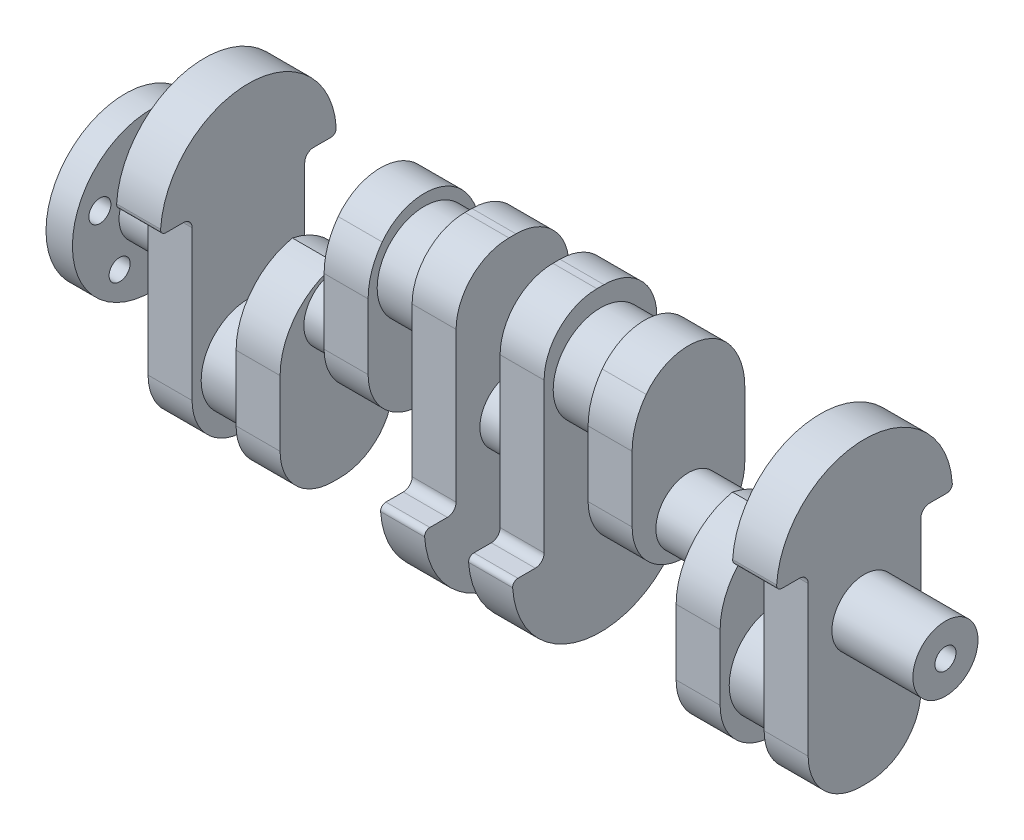
from build123d import *

# Parameters (mm, degrees)
SKETCH1_W           = 25
SKETCH1_H           = 26.85
SKETCH1_5_W         = 25
SKETCH1_5_H         = 26.85
SKETCH1_8_W         = 25
SKETCH1_8_H         = 18.498346322
SKETCH1_9_W         = 25
SKETCH1_9_H         = 170
SKETCH1_9_H_2       = 107.25
BOSS_EXTRUDE1_DEPTH = 32
FILLET1_R           = 30
FILLET3_R           = 40
SKETCH2_W           = 25
SKETCH2_H           = 50
BOSS_EXTRUDE2_DEPTH = 50
FILLET12_R          = 50
FILLET13_R          = 50
FILLET14_R          = 50
FILLET15_R          = 50
FILLET16_R          = 30
FILLET17_R          = 3
FILLET18_R          = 5
SKETCH3_R           = 18.498346322
BOSS_EXTRUDE3_DEPTH = 21
BOSS_EXTRUDE4_START = 5
SKETCH4_R           = 18.498346322
BOSS_EXTRUDE4_DEPTH = 5
SKETCH5_R           = 45
BOSS_EXTRUDE5_DEPTH = 15
CUT_EXTRUDE1_DEPTH  = 15
SKETCH7_R           = 6
CUT_EXTRUDE2_DEPTH  = 20


# Some blends are built 0.0001 mm under size
with BuildPart() as part:
    # Sketch1 → Revolve1 (revolve)
    with BuildSketch(Plane.XY, mode=Mode.PRIVATE) as revolve1_sk:
        with Locations((162.5, 61.175)):
            Rectangle(SKETCH1_W, SKETCH1_H)
        with Locations((262.5, 61.175)):
            Rectangle(SKETCH1_W, SKETCH1_H)
    revolve(revolve1_sk.sketch.rotate(Axis((150, 47.75, 0), (1, 0, 0)), 90), axis=Axis((150, 47.75, 0), (1, 0, 0)))



with BuildPart() as body_2:
    # Sketch1<5> → Revolve3 (revolve)
    with BuildSketch(Plane.XY, mode=Mode.PRIVATE) as revolve3_sk:
        with Locations((62.5, -34.325)):
            Rectangle(SKETCH1_5_W, SKETCH1_5_H)
        with Locations((362.5, -34.325)):
            Rectangle(SKETCH1_5_W, SKETCH1_5_H)
    revolve(revolve3_sk.sketch.rotate(Axis((50, -47.75, 0), (1, 0, 0)), 90), axis=Axis((50, -47.75, 0), (1, 0, 0)))


with BuildPart() as body_3:
    # Sketch1<8> → Revolve4 (revolve)
    with BuildSketch(Plane.XY, mode=Mode.PRIVATE) as revolve4_sk:
        with Locations((12.5, 9.249173161)):
            Rectangle(SKETCH1_8_W, SKETCH1_8_H)
        with Locations((112.5, 9.249173161)):
            Rectangle(SKETCH1_8_W, SKETCH1_8_H)
        with Locations((212.5, 9.249173161)):
            Rectangle(SKETCH1_8_W, SKETCH1_8_H)
        with Locations((312.5, 9.249173161)):
            Rectangle(SKETCH1_8_W, SKETCH1_8_H)
        with Locations((412.5, 9.249173161)):
            Rectangle(SKETCH1_8_W, SKETCH1_8_H)
    revolve(revolve4_sk.sketch.rotate(Axis((75, 0, 0), (1, 0, 0)), 90), axis=Axis((75, 0, 0), (1, 0, 0)))


with BuildPart() as part_1:
    add(part.part)

    add(body_2.part)  # Boss-Extrude1 merges body 2

    add(body_3.part)  # Boss-Extrude1 merges body 3
    # Sketch1<9> → Boss-Extrude1 (add, symmetric)
    with BuildSketch(Plane.XY):
        with Locations((37.5, 0)):
            Rectangle(SKETCH1_9_W, SKETCH1_9_H)
        with Locations((87.5, -31.375)):
            Rectangle(SKETCH1_9_W, SKETCH1_9_H_2)
        with Locations((187.5, 0)):
            Rectangle(SKETCH1_9_W, SKETCH1_9_H)
        with Locations((137.5, 31.375)):
            Rectangle(SKETCH1_9_W, SKETCH1_9_H_2)
        with Locations((237.5, 0)):
            Rectangle(SKETCH1_9_W, SKETCH1_9_H)
        with Locations((337.5, -31.375)):
            Rectangle(SKETCH1_9_W, SKETCH1_9_H_2)
        with Locations((287.5, 31.375)):
            Rectangle(SKETCH1_9_W, SKETCH1_9_H_2)
        with Locations((387.5, 0)):
            Rectangle(SKETCH1_9_W, SKETCH1_9_H)
    extrude(amount=BOSS_EXTRUDE1_DEPTH, both=True)

    # Fillet1
    fillet1_edges = [part_1.edges().sort_by_distance(p)[0] for p in [
        (37.5, -85, -32),
        (37.5, -85, 32),
        (137.5, -22.25, 32),
        (137.5, -22.25, -32),
        (87.5, -85, 32),
        (87.5, -85, -32),
        (187.5, 85, -32),
        (187.5, 85, 32),
        (237.5, 85, -32),
        (237.5, 85, 32),
        (287.5, -22.25, 32),
        (287.5, -22.25, -32),
        (337.5, -85, 32),
        (337.5, -85, -32),
        (387.5, -85, 32),
        (387.5, -85, -32),
    ]]
    fillet(fillet1_edges, radius=FILLET1_R)

    # Fillet3
    # the kernel refuses this fillet: 40 mm, written as the material it takes off along each edge
    with BuildSketch(Plane(origin=(400, 85, -32), x_dir=(0, -1, 0), z_dir=(-1, 0, 0))) as fillet3_piece_1_section:
        with BuildLine():
            CenterArc((FILLET3_R, FILLET3_R), FILLET3_R, 180, 90)
            Line((0, FILLET3_R), (0, 0))
            Line((0, 0), (FILLET3_R, 0))
        make_face()
    fillet3_piece_1 = extrude(amount=125, mode=Mode.PRIVATE)
    fillet3_piece_1 = split(fillet3_piece_1, bisect_by=Plane(origin=(375, 50.180054466, -31.891838311), z_dir=(-1, 0, 0)), keep=Keep.TOP, mode=Mode.PRIVATE)
    add(fillet3_piece_1, mode=Mode.SUBTRACT)
    with BuildSketch(Plane(origin=(400, 85, 32), x_dir=(0, 0, -1), z_dir=(-1, 0, 0))) as fillet3_piece_2_section:
        with BuildLine():
            CenterArc((FILLET3_R, FILLET3_R), FILLET3_R, 180, 90)
            Line((0, FILLET3_R), (0, 0))
            Line((0, 0), (FILLET3_R, 0))
        make_face()
    fillet3_piece_2 = extrude(amount=125, mode=Mode.PRIVATE)
    fillet3_piece_2 = split(fillet3_piece_2, bisect_by=Plane(origin=(375, 84.961169629, -4.892183964), z_dir=(-1, 0, 0)), keep=Keep.TOP, mode=Mode.PRIVATE)
    add(fillet3_piece_2, mode=Mode.SUBTRACT)
    with BuildSketch(Plane(origin=(250, 85, -32), x_dir=(0, -1, 0), z_dir=(-1, 0, 0))) as fillet3_piece_3_section:
        with BuildLine():
            CenterArc((FILLET3_R, FILLET3_R), FILLET3_R, 180, 90)
            Line((0, FILLET3_R), (0, 0))
            Line((0, 0), (FILLET3_R, 0))
        make_face()
    fillet3_piece_3 = extrude(amount=125, mode=Mode.PRIVATE)
    fillet3_piece_3 = split(fillet3_piece_3, bisect_by=Plane(origin=(175, 50.180054466, -31.891838311), z_dir=(-1, 0, 0)), keep=Keep.TOP, mode=Mode.PRIVATE)
    add(fillet3_piece_3, mode=Mode.SUBTRACT)
    with BuildSketch(Plane(origin=(250, 85, 32), x_dir=(0, 0, -1), z_dir=(-1, 0, 0))) as fillet3_piece_4_section:
        with BuildLine():
            CenterArc((FILLET3_R, FILLET3_R), FILLET3_R, 180, 90)
            Line((0, FILLET3_R), (0, 0))
            Line((0, 0), (FILLET3_R, 0))
        make_face()
    fillet3_piece_4 = extrude(amount=125, mode=Mode.PRIVATE)
    fillet3_piece_4 = split(fillet3_piece_4, bisect_by=Plane(origin=(175, 84.961169629, -4.892183964), z_dir=(-1, 0, 0)), keep=Keep.TOP, mode=Mode.PRIVATE)
    add(fillet3_piece_4, mode=Mode.SUBTRACT)
    with BuildSketch(Plane(origin=(450, 22.25, -32), x_dir=(0, -1, 0), z_dir=(-1, 0, 0))) as fillet3_piece_5_section:
        with BuildLine():
            CenterArc((FILLET3_R, FILLET3_R), FILLET3_R, 180, 90)
            Line((0, FILLET3_R), (0, 0))
            Line((0, 0), (FILLET3_R, 0))
        make_face()
    fillet3_piece_5 = extrude(amount=125, mode=Mode.PRIVATE)
    fillet3_piece_5 = split(fillet3_piece_5, bisect_by=Plane(origin=(375, -4.532523645, -31.278935782), z_dir=(-1, 0, 0)), keep=Keep.TOP, mode=Mode.PRIVATE)
    add(fillet3_piece_5, mode=Mode.SUBTRACT)
    with BuildSketch(Plane(origin=(450, 22.25, 32), x_dir=(0, 0, -1), z_dir=(-1, 0, 0))) as fillet3_piece_6_section:
        with BuildLine():
            CenterArc((FILLET3_R, FILLET3_R), FILLET3_R, 180, 90)
            Line((0, FILLET3_R), (0, 0))
            Line((0, 0), (FILLET3_R, 0))
        make_face()
    fillet3_piece_6 = extrude(amount=125, mode=Mode.PRIVATE)
    fillet3_piece_6 = split(fillet3_piece_6, bisect_by=Plane(origin=(375, 21.818010891, 2.113463403), z_dir=(-1, 0, 0)), keep=Keep.TOP, mode=Mode.PRIVATE)
    add(fillet3_piece_6, mode=Mode.SUBTRACT)
    with BuildSketch(Plane(origin=(200, 22.25, -32), x_dir=(0, -1, 0), z_dir=(-1, 0, 0))) as fillet3_piece_7_section:
        with BuildLine():
            CenterArc((FILLET3_R, FILLET3_R), FILLET3_R, 180, 90)
            Line((0, FILLET3_R), (0, 0))
            Line((0, 0), (FILLET3_R, 0))
        make_face()
    fillet3_piece_7 = extrude(amount=125, mode=Mode.PRIVATE)
    fillet3_piece_7 = split(fillet3_piece_7, bisect_by=Plane(origin=(125, -4.532523645, -31.278935782), z_dir=(-1, 0, 0)), keep=Keep.TOP, mode=Mode.PRIVATE)
    add(fillet3_piece_7, mode=Mode.SUBTRACT)
    with BuildSketch(Plane(origin=(200, 22.25, 32), x_dir=(0, 0, -1), z_dir=(-1, 0, 0))) as fillet3_piece_8_section:
        with BuildLine():
            CenterArc((FILLET3_R, FILLET3_R), FILLET3_R, 180, 90)
            Line((0, FILLET3_R), (0, 0))
            Line((0, 0), (FILLET3_R, 0))
        make_face()
    fillet3_piece_8 = extrude(amount=125, mode=Mode.PRIVATE)
    fillet3_piece_8 = split(fillet3_piece_8, bisect_by=Plane(origin=(125, 21.818010891, 2.113463403), z_dir=(-1, 0, 0)), keep=Keep.TOP, mode=Mode.PRIVATE)
    add(fillet3_piece_8, mode=Mode.SUBTRACT)

    # Sketch2 → Boss-Extrude2 (add, symmetric)
    with BuildSketch(Plane.XY):
        with Locations((37.5, 60)):
            Rectangle(SKETCH2_W, SKETCH2_H)
        with Locations((187.5, -60)):
            Rectangle(SKETCH2_W, SKETCH2_H)
        with Locations((237.5, -60)):
            Rectangle(SKETCH2_W, SKETCH2_H)
        with Locations((387.5, 60)):
            Rectangle(SKETCH2_W, SKETCH2_H)
    extrude(amount=BOSS_EXTRUDE2_DEPTH, both=True)

    # Fillet12
    fillet12_edges = [part_1.edges().sort_by_distance(p)[0] for p in [
        (37.5, 85, -50),
        (37.5, 85, 50),
    ]]
    fillet(fillet12_edges, radius=FILLET12_R - 0.0001)  # a hair under: the kernel refuses the full size

    # Fillet13
    fillet13_edges = [part_1.edges().sort_by_distance(p)[0] for p in [
        (387.5, 85, -50),
        (387.5, 85, 50),
    ]]
    fillet(fillet13_edges, radius=FILLET13_R - 0.0001)  # a hair under: the kernel refuses the full size

    # Fillet14
    fillet14_edges = [part_1.edges().sort_by_distance(p)[0] for p in [
        (187.5, -85, -50),
        (187.5, -85, 50),
    ]]
    fillet(fillet14_edges, radius=FILLET14_R - 0.0001)  # a hair under: the kernel refuses the full size

    # Fillet15
    fillet15_edges = [part_1.edges().sort_by_distance(p)[0] for p in [
        (237.5, -85, -50),
        (237.5, -85, 50),
    ]]
    fillet(fillet15_edges, radius=FILLET15_R - 0.0001)  # a hair under: the kernel refuses the full size

    # Fillet16
    fillet16_edges = [part_1.edges().sort_by_distance(p)[0] for p in [
        (287.5, 84.191835885, 0),
        (137.5, 84.191835885, 0),
    ]]
    fillet(fillet16_edges, radius=FILLET16_R)

    # Fillet17
    fillet17_edges = [part_1.edges().sort_by_distance(p)[0] for p in [
        (37.5, 35, -50),
        (37.5, 35, 50),
        (187.5, -35, -50),
        (187.5, -35, 50),
        (237.5, -35, -50),
        (237.5, -35, 50),
        (387.5, 35, -50),
        (387.5, 35, 50),
    ]]
    fillet(fillet17_edges, radius=FILLET17_R)

    # Fillet18
    fillet18_edges = [part_1.edges().sort_by_distance(p)[0] for p in [
        (37.5, 35, -32),
        (387.5, 35, -32),
        (237.5, -35, -32),
        (187.5, -35, -32),
        (37.5, 35, 32),
        (187.5, -35, 32),
        (237.5, -35, 32),
        (387.5, 35, 32),
    ]]
    fillet(fillet18_edges, radius=FILLET18_R)

    # Sketch3 → Boss-Extrude3 (add)
    with BuildSketch(Plane(origin=(425, 0, 0), x_dir=(0, 0, -1), z_dir=(1, 0, 0))):
        with Locations(Location((0, 0, 0), (0, 0, 180))):
            Circle(SKETCH3_R)
    extrude(amount=BOSS_EXTRUDE3_DEPTH)

    # Sketch4 → Boss-Extrude4 (add)
    with BuildSketch(Plane.ZY.offset(BOSS_EXTRUDE4_START)):
        Circle(SKETCH4_R)
    extrude(amount=-BOSS_EXTRUDE4_DEPTH)

    # Sketch5 → Boss-Extrude5 (add)
    with BuildSketch(Plane.ZY.offset(5)):
        Circle(SKETCH5_R)
    extrude(amount=BOSS_EXTRUDE5_DEPTH)

    # Sketch6 → Cut-Extrude1 (cut)
    with BuildSketch(Plane.ZY.offset(20)):
        with BuildLine():
            ThreePointArc((-23.389262615, 9.549150281), (-23.682923517, 11.403252248), (-24.535160648, 13.075861795))
            Line((-24.535160648, 13.075861795), (-29.389262615, 9.549150281))
            Line((-29.389262615, 9.549150281), (-27.535160648, 3.842811183))
            ThreePointArc((-27.535160648, 3.842811183), (-24.535160648, 6.022438767), (-23.389262615, 9.549150281))
        make_face()
        with BuildLine():
            Line((-29.389262615, 9.549150281), (-24.535160648, 13.075861795))
            ThreePointArc((-24.535160648, 13.075861795), (-35.095601712, 11.403252248), (-27.535160648, 3.842811183))
            Line((-27.535160648, 3.842811183), (-29.389262615, 9.549150281))
        make_face()
        with BuildLine():
            Line((4.854101966, 27.374987924), (0, 30.901699437))
            Line((0, 30.901699437), (-4.854101966, 27.374987924))
            ThreePointArc((-4.854101966, 27.374987924), (0, 24.901699437), (4.854101966, 27.374987924))
        make_face()
        with BuildLine():
            Line((-4.854101966, 27.374987924), (0, 30.901699437))
            Line((0, 30.901699437), (4.854101966, 27.374987924))
            ThreePointArc((4.854101966, 27.374987924), (5.706339098, 29.047597471), (6, 30.901699437))
            ThreePointArc((6, 30.901699437), (-1.854101966, 36.608038535), (-4.854101966, 27.374987924))
        make_face()
        with BuildLine():
            ThreePointArc((35.641636605, 9.549150281), (31.321352433, 15.495511307), (24.330985801, 13.224203505))
            Line((24.330985801, 13.224203505), (29.389262615, 9.549150281))
            Line((29.389262615, 9.549150281), (27.457172796, 3.602789255))
            ThreePointArc((27.457172796, 3.602789255), (33.064315838, 4.490873468), (35.641636605, 9.549150281))
        make_face()
        with BuildLine():
            Line((29.389262615, 9.549150281), (24.330985801, 13.224203505))
            ThreePointArc((24.330985801, 13.224203505), (23.442901589, 7.617060463), (27.457172796, 3.602789255))
            Line((27.457172796, 3.602789255), (29.389262615, 9.549150281))
        make_face()
        with BuildLine():
            ThreePointArc((24.1635632, -25), (23.017665166, -21.473288486), (20.017665166, -19.293660902))
            Line((20.017665166, -19.293660902), (18.1635632, -25))
            Line((18.1635632, -25), (12.1635632, -25))
            ThreePointArc((12.1635632, -25), (18.1635632, -31), (24.1635632, -25))
        make_face()
        with BuildLine():
            Line((18.1635632, -25), (20.017665166, -19.293660902))
            ThreePointArc((20.017665166, -19.293660902), (14.636851686, -20.145898034), (12.1635632, -25))
            Line((12.1635632, -25), (18.1635632, -25))
        make_face()
        with BuildLine():
            ThreePointArc((-12.1635632, -25), (-14.636851686, -20.145898034), (-20.017665166, -19.293660902))
            Line((-20.017665166, -19.293660902), (-18.1635632, -25))
            Line((-18.1635632, -25), (-12.1635632, -25))
        make_face()
        with BuildLine():
            Line((-18.1635632, -25), (-20.017665166, -19.293660902))
            ThreePointArc((-20.017665166, -19.293660902), (-21.690274714, -29.854101966), (-12.1635632, -25))
            Line((-12.1635632, -25), (-18.1635632, -25))
        make_face()
    extrude(amount=-CUT_EXTRUDE1_DEPTH, mode=Mode.SUBTRACT)

    # Sketch7 → Cut-Extrude2 (cut)
    with BuildSketch(Plane(origin=(446, 0, 0), x_dir=(0, 0, -1), z_dir=(1, 0, 0))):
        Circle(SKETCH7_R)
    extrude(amount=-CUT_EXTRUDE2_DEPTH, mode=Mode.SUBTRACT)


solid = part_1.part
